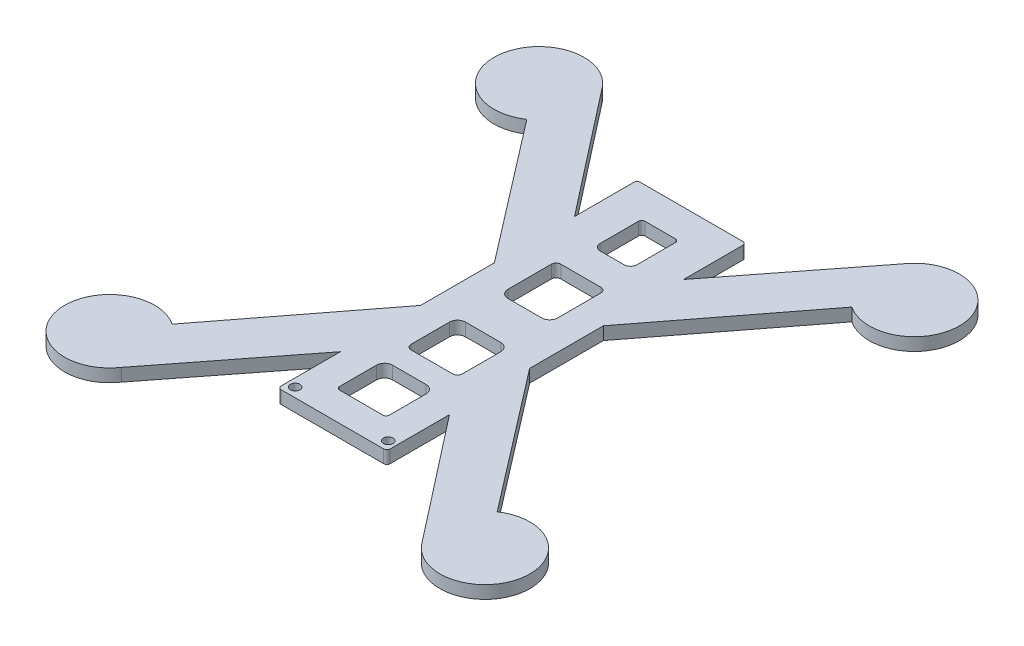
from build123d import *

# Parameters (mm, degrees)
FRAME_SKETCH_R           = 1.5
FRAME_BOTTOM_PLATE_DEPTH = 4


with BuildPart() as part:
    # Frame Sketch → Frame Bottom Plate (new body)
    with BuildSketch(Plane(origin=(0, 0, 0), x_dir=(1, 0, 0), z_dir=(0, 1, 0))):
        with BuildLine():
            Line((-48.674660208, 55.289940373), (-15, 11.5))
            Line((-15, 11.5), (-15, -11.5))
            Line((-15, -11.5), (-48.674660208, -55.289940373))
            ThreePointArc((-48.674660208, -55.289940373), (-70.286313942, -69.618055258), (-44.885336906, -74.828508108))
            Line((-44.885336906, -74.828508108), (-15, -36.5))
            Line((-15, -36.5), (-15, -55))
            ThreePointArc((-15, -55), (-14.707106781, -55.707106781), (-14, -56))
            Line((-14, -56), (18, -56))
            ThreePointArc((18, -56), (18.707106781, -55.707106781), (19, -55))
            Line((19, -55), (19, -36.5))
            Line((19, -36.5), (50.024838487, -76.289940373))
            ThreePointArc((50.024838487, -76.289940373), (74.432680647, -68.702590503), (52.674660208, -55.289940373))
            Line((52.674660208, -55.289940373), (19, -11.5))
            Line((19, -11.5), (19, 11.5))
            Line((19, 11.5), (52.674660208, 55.289940373))
            ThreePointArc((52.674660208, 55.289940373), (74.286313942, 69.618055258), (48.885336906, 74.828508108))
            Line((48.885336906, 74.828508108), (19, 36.5))
            Line((19, 36.5), (19, 55))
            ThreePointArc((19, 55), (18.707106781, 55.707106781), (18, 56))
            Line((18, 56), (-14, 56))
            ThreePointArc((-14, 56), (-14.707106781, 55.707106781), (-15, 55))
            Line((-15, 55), (-15, 36.5))
            Line((-15, 36.5), (-44.885336906, 74.828508108))
            ThreePointArc((-44.885336906, 74.828508108), (-70.286313942, 69.618055258), (-48.674660208, 55.289940373))
        make_face()
        with BuildLine():
            ThreePointArc((-1.75, 31.199126209), (-3.164213562, 31.784912646), (-3.75, 33.199126209))
            Line((-3.75, 33.199126209), (-3.75, 45.199126209))
            ThreePointArc((-3.75, 45.199126209), (-3.457106781, 45.90623299), (-2.75, 46.199126209))
            Line((-2.75, 46.199126209), (6.75, 46.199126209))
            ThreePointArc((6.75, 46.199126209), (7.457106781, 45.90623299), (7.75, 45.199126209))
            Line((7.75, 45.199126209), (7.75, 33.199126209))
            ThreePointArc((7.75, 33.199126209), (7.164213562, 31.784912646), (5.75, 31.199126209))
            Line((5.75, 31.199126209), (-1.75, 31.199126209))
        make_face(mode=Mode.SUBTRACT)
        with Locations((-12.5, -53.1)):
            Circle(FRAME_SKETCH_R, mode=Mode.SUBTRACT)
        with Locations((16.5, -53.1)):
            Circle(FRAME_SKETCH_R, mode=Mode.SUBTRACT)
        with BuildLine():
            Line((8.75, -47), (-4.75, -47))
            ThreePointArc((-4.75, -47), (-5.457106781, -46.707106781), (-5.75, -46))
            Line((-5.75, -46), (-5.75, -34.5))
            ThreePointArc((-5.75, -34.5), (-5.017766953, -32.732233047), (-3.25, -32))
            Line((-3.25, -32), (7.25, -32))
            ThreePointArc((7.25, -32), (9.017766953, -32.732233047), (9.75, -34.5))
            Line((9.75, -34.5), (9.75, -46))
            ThreePointArc((9.75, -46), (9.457106781, -46.707106781), (8.75, -47))
        make_face(mode=Mode.SUBTRACT)
        with BuildLine():
            ThreePointArc((10, -23.5), (9.560660172, -24.560660172), (8.5, -25))
            Line((8.5, -25), (-4.5, -25))
            ThreePointArc((-4.5, -25), (-5.560660172, -24.560660172), (-6, -23.5))
            Line((-6, -23.5), (-6, -11.5))
            ThreePointArc((-6, -11.5), (-5.267766953, -9.732233047), (-3.5, -9))
            Line((-3.5, -9), (7.5, -9))
            ThreePointArc((7.5, -9), (9.267766953, -9.732233047), (10, -11.5))
            Line((10, -11.5), (10, -23.5))
        make_face(mode=Mode.SUBTRACT)
        with BuildLine():
            Line((7.25, 4), (-3.25, 4))
            ThreePointArc((-3.25, 4), (-5.017766953, 4.732233047), (-5.75, 6.5))
            Line((-5.75, 6.5), (-5.75, 20))
            ThreePointArc((-5.75, 20), (-5.310660172, 21.060660172), (-4.25, 21.5))
            Line((-4.25, 21.5), (8.25, 21.5))
            ThreePointArc((8.25, 21.5), (9.310660172, 21.060660172), (9.75, 20))
            Line((9.75, 20), (9.75, 6.5))
            ThreePointArc((9.75, 6.5), (9.017766953, 4.732233047), (7.25, 4))
        make_face(mode=Mode.SUBTRACT)
    extrude(amount=FRAME_BOTTOM_PLATE_DEPTH)


solid = part.part
